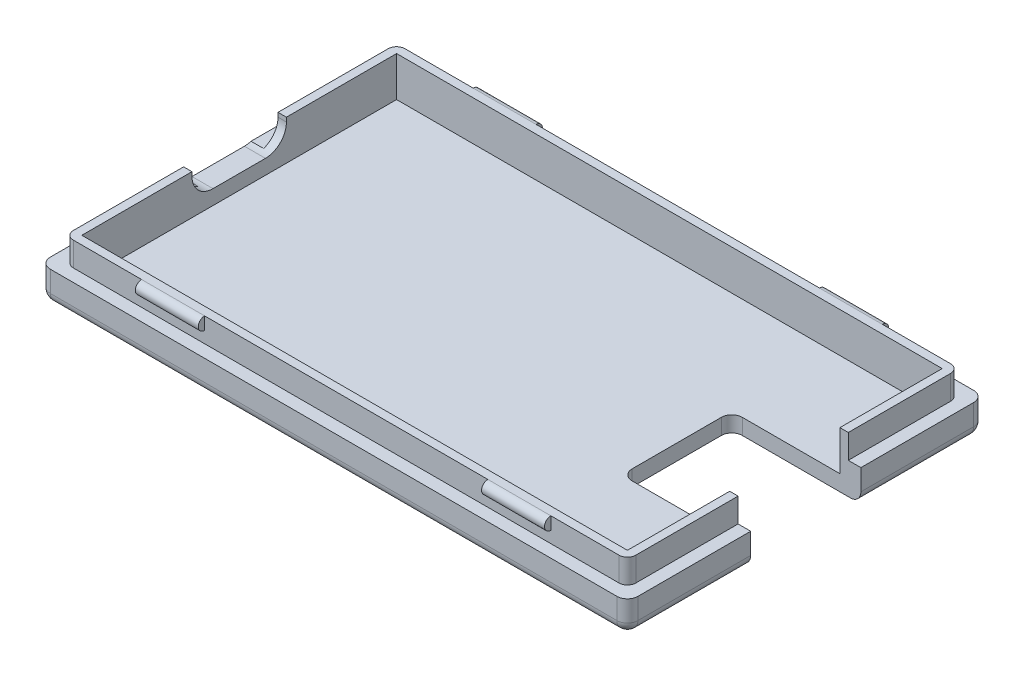
from build123d import *

# Parameters (mm, degrees)
SKETCH1_W             = 56
SKETCH1_H             = 34
BASE_DEPTH            = 1.5
SKETCH1_3_W           = 56
SKETCH1_3_H           = 34
SKETCH1_3_W_2         = 52
SKETCH1_3_H_2         = 30
BOSS_EXTRUDE2_DEPTH   = 3
SKETCH2_W             = 53.6
SKETCH2_H             = 31.6
SKETCH2_W_2           = 52
SKETCH2_H_2           = 30
WALL_DEPTH            = 2.3
SKETCH3_W             = 1.2
SKETCH3_H             = 3.75
GROOVEFOROPEN_DEPTH   = 1
LOCKPINS_START        = 13.5
SKETCH4_R             = 0.6
LOCKPINS_DEPTH        = 6
FILLETBASE_R          = 1
FILLETINNER_R         = 0.8
CUTCABLE_DEPTH        = 34.182676203
CUTFORCONNECTOR_DEPTH = 34.182676203


with BuildPart() as part:
    # Sketch1 → Base (new body)
    with BuildSketch(Plane(origin=(0, 0, 0), x_dir=(1, 0, 0), z_dir=(0, 1, 0))):
        Rectangle(SKETCH1_W, SKETCH1_H)
    extrude(amount=BASE_DEPTH)

    # Sketch1<3> → Boss-Extrude2 (add)
    with BuildSketch(Plane(origin=(0, 0, 0), x_dir=(1, 0, 0), z_dir=(0, 1, 0))):
        Rectangle(SKETCH1_3_W, SKETCH1_3_H)
        Rectangle(SKETCH1_3_W_2, SKETCH1_3_H_2, mode=Mode.SUBTRACT)
    extrude(amount=BOSS_EXTRUDE2_DEPTH)

    # Sketch2 → Wall (add)
    with BuildSketch(Plane(origin=(0, 3, 0), x_dir=(1, 0, 0), z_dir=(0, 1, 0))):
        Rectangle(SKETCH2_W, SKETCH2_H)
        Rectangle(SKETCH2_W_2, SKETCH2_H_2, mode=Mode.SUBTRACT)
    extrude(amount=WALL_DEPTH)

    # Sketch3 → GrooveForOpen (cut)
    with BuildSketch(Plane(origin=(0, 3, 0), x_dir=(1, 0, 0), z_dir=(0, 1, 0))):
        with Locations((-27.4, -8.375)):
            Rectangle(SKETCH3_W, SKETCH3_H)
        with Locations((-27.4, 8.375)):
            Rectangle(SKETCH3_W, SKETCH3_H)
    extrude(amount=-GROOVEFOROPEN_DEPTH, mode=Mode.SUBTRACT)

    # Sketch4 → LockPins (add)
    with BuildSketch(Plane(origin=(0, 0, 0), x_dir=(0, 0, -1), z_dir=(1, 0, 0)).offset(LOCKPINS_START)):
        with Locations((15.8, 4.7)):
            Circle(SKETCH4_R)
        with Locations((-15.8, 4.7)):
            Circle(SKETCH4_R)
    lockpins = extrude(amount=LOCKPINS_DEPTH)

    # LockPins2: LockPins across plane
    add(lockpins.mirror(Plane(origin=(0, 0, 0), x_dir=(0, 0, 1), z_dir=(1, 0, 0))))

    # FilletBase
    filletbase_edges = [part.edges().sort_by_distance(p)[0] for p in [
        (0, 0, 17),
        (28, 0, 0),
        (0, 0, -17),
        (-28, 0, 0),
        (28, 1.5, 17),
        (-28, 1.5, 17),
        (-28, 1.5, -17),
        (28, 1.5, -17),
    ]]
    fillet(filletbase_edges, radius=FILLETBASE_R)

    # FilletInner
    filletinner_edges = [part.edges().sort_by_distance(p)[0] for p in [
        (26.8, 4.15, 15.8),
        (-26.8, 4.15, 15.8),
        (-26.8, 4.15, -15.8),
        (26.8, 4.15, -15.8),
    ]]
    fillet(filletinner_edges, radius=FILLETINNER_R)

    # Sketch5 → CutCable (cut, through all)
    with BuildSketch(Plane(origin=(0, 0, 0), x_dir=(0, 0, -1), z_dir=(1, 0, 0))):
        with BuildLine():
            Line((-4.5, 5.462258994), (4.5, 5.462258994))
            Line((4.5, 5.462258994), (4.5, 4.9))
            ThreePointArc((4.5, 4.9), (3.914213562, 3.485786438), (2.5, 2.9))
            Line((2.5, 2.9), (-2.5, 2.9))
            ThreePointArc((-2.5, 2.9), (-3.914213562, 3.485786438), (-4.5, 4.9))
            Line((-4.5, 4.9), (-4.5, 5.462258994))
        make_face()
    extrude(amount=-CUTCABLE_DEPTH, mode=Mode.SUBTRACT)

    # Sketch7 → CutForConnector (cut, through all)
    with BuildSketch(Plane.XZ):
        with BuildLine():
            Line((28.0151422, -5.25), (16.7, -5.25))
            ThreePointArc((16.7, -5.25), (15.992893219, -4.957106781), (15.7, -4.25))
            Line((15.7, -4.25), (15.7, 4.25))
            ThreePointArc((15.7, 4.25), (15.992893219, 4.957106781), (16.7, 5.25))
            Line((16.7, 5.25), (28.0151422, 5.25))
            Line((28.0151422, 5.25), (28.0151422, -5.25))
        make_face()
    extrude(amount=-CUTFORCONNECTOR_DEPTH, mode=Mode.SUBTRACT)


solid = part.part
